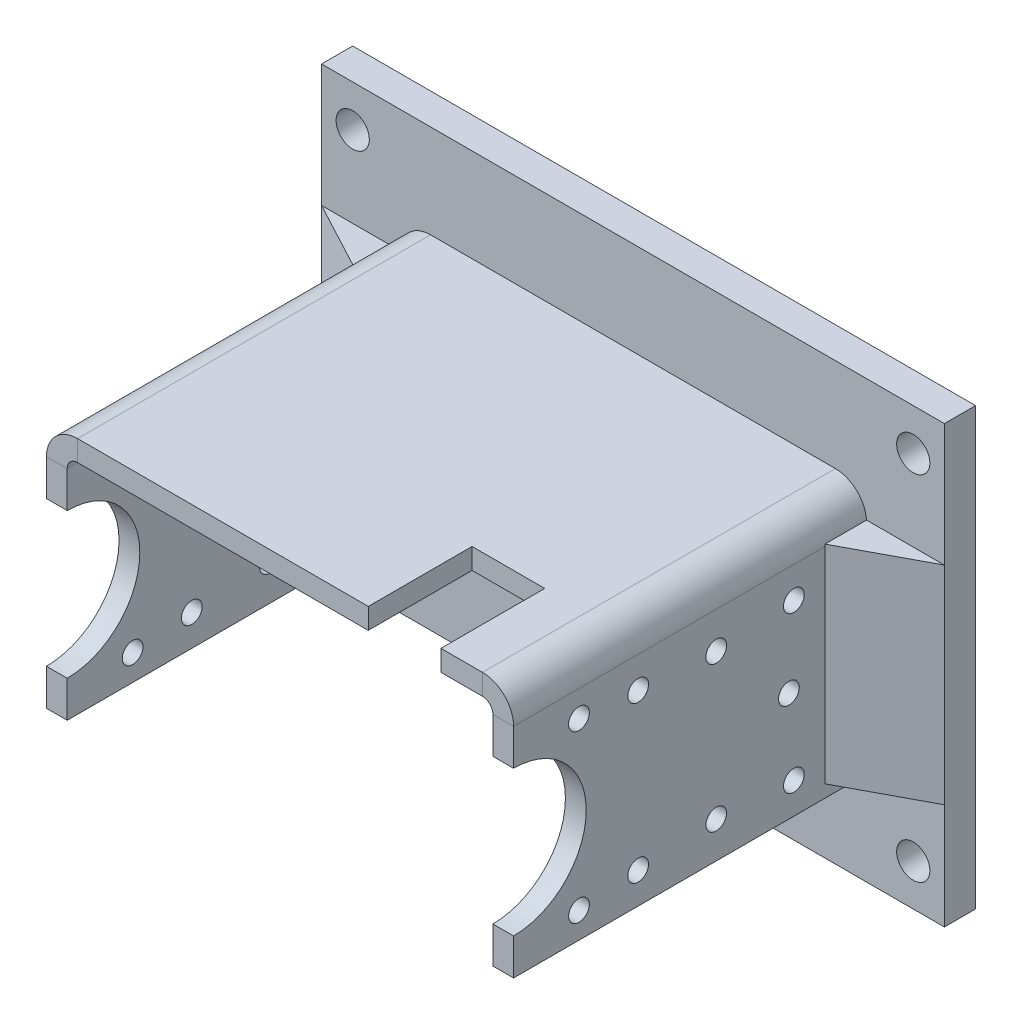
from build123d import *

# Parameters (mm, degrees)
SM_BASE_FLANGE_1_DEPTH = 30
SKETCH_6_R             = 1
CUT_EXTRUDE_1_DEPTH    = 56.577333509
SKETCH_7_W             = 7
SKETCH_7_H             = 10
CUT_EXTRUDE_2_DEPTH    = 45.522466239
EXTRUDE_START          = 4
EXTRUDE_1_DEPTH        = 4
SKETCH_9_W             = 60
SKETCH_9_H             = 42
SKETCH_9_R             = 1.6
EXTRUDE_2_DEPTH        = 3
SKETCH_13_R            = 1
SKETCH_13_R_2          = 0.99
CUT_EXTRUDE_6_DEPTH    = 65.277401573
EXTRUDE_4_DEPTH        = 10


# Read off the part's stored shape, not the designer's step: 基体-法兰1
with BuildPart() as part:
    # 基体-法兰1 outline → 基体-法兰1 (new body)
    with BuildSketch(Plane.XY):
        with BuildLine():
            Line((-22.5, 9.8), (-22.5, -11.2))
            Line((-22.5, -11.2), (-20.5, -11.2))
            Line((-20.5, -11.2), (-20.5, 9.8))
            ThreePointArc((-20.5, 9.8), (-20.207106781, 10.507106781), (-19.5, 10.8))
            Line((-19.5, 10.8), (19.5, 10.8))
            ThreePointArc((19.5, 10.8), (20.207106781, 10.507106781), (20.5, 9.8))
            Line((20.5, 9.8), (20.5, -11.2))
            Line((20.5, -11.2), (22.5, -11.2))
            Line((22.5, -11.2), (22.5, 9.8))
            ThreePointArc((22.5, 9.8), (21.621320344, 11.921320344), (19.5, 12.8))
            Line((19.5, 12.8), (-19.5, 12.8))
            ThreePointArc((-19.5, 12.8), (-21.621320344, 11.921320344), (-22.5, 9.8))
        make_face()
    extrude(amount=SM_BASE_FLANGE_1_DEPTH)

    # 草图6 → 切除-拉伸1 (cut, through all)
    with BuildSketch(Plane.ZY.offset(22.5)):
        with BuildLine():
            Line((30, -7.692697161), (30, 6.292697161))
            ThreePointArc((30, 6.292697161), (23.007302839, -0.7), (30, -7.692697161))
        make_face()
        with Locations((3, 6.8)):
            Circle(SKETCH_6_R)
        with Locations((18, 6.8)):
            Circle(SKETCH_6_R)
        with Locations((18, -8.2)):
            Circle(SKETCH_6_R)
        with Locations((3, -8.2)):
            Circle(SKETCH_6_R)
    extrude(amount=-CUT_EXTRUDE_1_DEPTH, mode=Mode.SUBTRACT)

    # 草图7 → 切除-拉伸2 (cut, through all)
    with BuildSketch(Plane(origin=(0, 12.8, 0), x_dir=(1, 0, 0), z_dir=(0, 1, 0))):
        with Locations((12, -25)):
            Rectangle(SKETCH_7_W, SKETCH_7_H)
    extrude(amount=-CUT_EXTRUDE_2_DEPTH, mode=Mode.SUBTRACT)

    # 草图8 → 凸台-拉伸1 (add)
    with BuildSketch(Plane(origin=(0, 0, 0), x_dir=(-1, 0, 0), z_dir=(0, 0, -1)).offset(EXTRUDE_START)):
        with BuildLine():
            Line((-20.5, -11.2), (-20.5, 9.8))
            ThreePointArc((-20.5, 9.8), (-20.207106781, 10.507106781), (-19.5, 10.8))
            Line((-19.5, 10.8), (19.5, 10.8))
            ThreePointArc((19.5, 10.8), (20.207106781, 10.507106781), (20.5, 9.8))
            Line((20.5, 9.8), (20.5, -11.2))
            Line((20.5, -11.2), (22.5, -11.2))
            Line((22.5, -11.2), (22.5, 9.8))
            ThreePointArc((22.5, 9.8), (21.621320344, 11.921320344), (19.5, 12.8))
            Line((19.5, 12.8), (-19.5, 12.8))
            ThreePointArc((-19.5, 12.8), (-21.621320344, 11.921320344), (-22.5, 9.8))
            Line((-22.5, 9.8), (-22.5, -11.2))
            Line((-22.5, -11.2), (-20.5, -11.2))
        make_face()
    extrude(amount=-EXTRUDE_1_DEPTH)

    # 草图9 → 凸台-拉伸2 (add)
    with BuildSketch(Plane(origin=(0, 0, -4), x_dir=(-1, 0, 0), z_dir=(0, 0, -1))):
        with Locations((0, 0.802163953)):
            Rectangle(SKETCH_9_W, SKETCH_9_H)
        with Locations((-27, 17.802163953)):
            Circle(SKETCH_9_R, mode=Mode.SUBTRACT)
        with Locations((27, 17.802163953)):
            Circle(SKETCH_9_R, mode=Mode.SUBTRACT)
        with Locations((27, -16.197836047)):
            Circle(SKETCH_9_R, mode=Mode.SUBTRACT)
        with Locations((-27, -16.197836047)):
            Circle(SKETCH_9_R, mode=Mode.SUBTRACT)
        with Locations((0, 7.802163953)):
            Circle(SKETCH_9_R, mode=Mode.SUBTRACT)
        with Locations((7, 0.802163953)):
            Circle(SKETCH_9_R, mode=Mode.SUBTRACT)
        with Locations((0, -6.197836047)):
            Circle(SKETCH_9_R, mode=Mode.SUBTRACT)
        with Locations((-7, 0.802163953)):
            Circle(SKETCH_9_R, mode=Mode.SUBTRACT)
        with Locations((0, 0.802163953)):
            Circle(SKETCH_9_R, mode=Mode.SUBTRACT)
    extrude(amount=EXTRUDE_2_DEPTH)

    # 草图13 → 切除-拉伸6 (cut, through all)
    with BuildSketch(Plane(origin=(22.5, 0, 0), x_dir=(0, 0, -1), z_dir=(1, 0, 0))):
        with Locations(Location((-23.7, 7.3, 0), (0, 0, 90))):
            Circle(SKETCH_13_R)
        with Locations(Location((-10.48, 6.3, 0), (0, 0, 90))):
            Circle(SKETCH_13_R)
        with Locations(Location((-3.48, -0.7, 0), (0, 0, 90))):
            Circle(SKETCH_13_R)
        with Locations(Location((-23.7, -8.7, 0), (0, 0, 90))):
            Circle(SKETCH_13_R)
        with Locations(Location((-10.48, -7.7, 0), (0, 0, 90))):
            Circle(SKETCH_13_R_2)
    extrude(amount=-CUT_EXTRUDE_6_DEPTH, mode=Mode.SUBTRACT)

    # 草图17 → 凸台-拉伸4 (add, symmetric)
    with BuildSketch(Plane(origin=(0, 0, 0), x_dir=(1, 0, 0), z_dir=(0, 1, 0))):
        Polygon((-30, 4), (-22.5, 0), (-22.5, 4), align=None)
        Polygon((22.5, 0), (22.5, 4), (30, 4), align=None)
    extrude(amount=EXTRUDE_4_DEPTH, both=True)


solid = part.part
